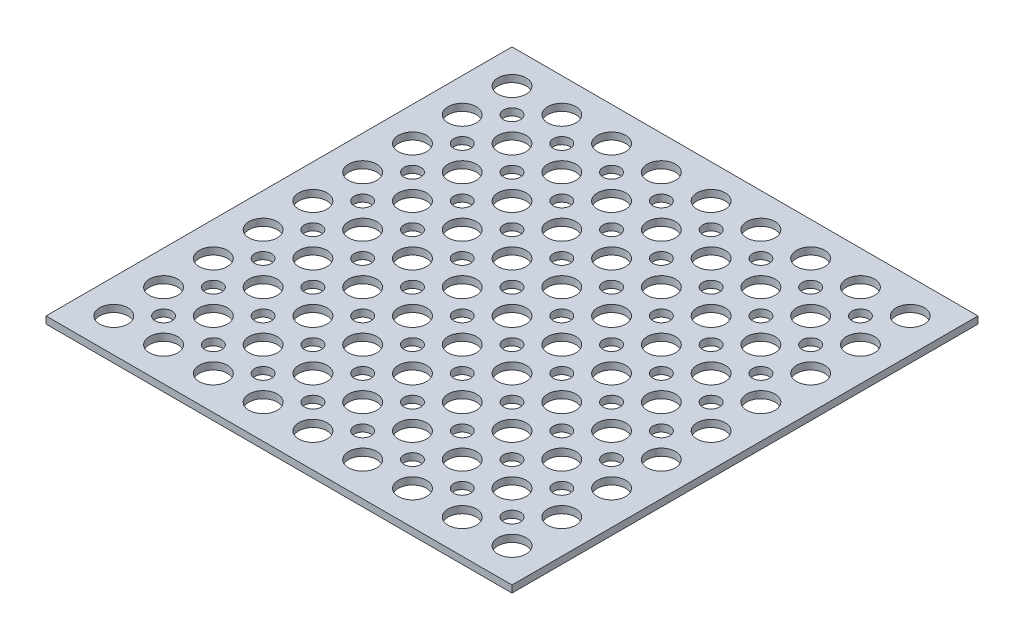
from build123d import *

# Parameters (mm, degrees)
SKETCH1_W           = 165
SKETCH1_H           = 165
BOSS_EXTRUDE1_DEPTH = 2.5
SKETCH2_R           = 5
SKETCH2_R_2         = 3
CUT_EXTRUDE1_DEPTH  = 2.5


with BuildPart() as part:
    # Sketch1 → Boss-Extrude1 (new body)
    with BuildSketch(Plane(origin=(0, 0, 0), x_dir=(1, 0, 0), z_dir=(0, 1, 0))):
        with Locations((82.5, 82.5)):
            Rectangle(SKETCH1_W, SKETCH1_H)
    extrude(amount=BOSS_EXTRUDE1_DEPTH)

    # Sketch2 → Cut-Extrude1 (cut)
    with BuildSketch(Plane(origin=(0, 2.5, 0), x_dir=(1, 0, 0), z_dir=(0, 1, 0))):
        with Locations((12, 153)):
            Circle(SKETCH2_R)
        with Locations((29.625, 153)):
            Circle(SKETCH2_R)
        with Locations((47.25, 153)):
            Circle(SKETCH2_R)
        with Locations((64.875, 153)):
            Circle(SKETCH2_R)
        with Locations((82.5, 153)):
            Circle(SKETCH2_R)
        with Locations((100.125, 153)):
            Circle(SKETCH2_R)
        with Locations((117.75, 153)):
            Circle(SKETCH2_R)
        with Locations((135.375, 153)):
            Circle(SKETCH2_R)
        with Locations((153, 153)):
            Circle(SKETCH2_R)
        with Locations((29.625, 135.375)):
            Circle(SKETCH2_R)
        with Locations((47.25, 135.375)):
            Circle(SKETCH2_R)
        with Locations((64.875, 135.375)):
            Circle(SKETCH2_R)
        with Locations((82.5, 135.375)):
            Circle(SKETCH2_R)
        with Locations((100.125, 135.375)):
            Circle(SKETCH2_R)
        with Locations((117.75, 135.375)):
            Circle(SKETCH2_R)
        with Locations((135.375, 135.375)):
            Circle(SKETCH2_R)
        with Locations((153, 135.375)):
            Circle(SKETCH2_R)
        with Locations((29.625, 117.75)):
            Circle(SKETCH2_R)
        with Locations((47.25, 117.75)):
            Circle(SKETCH2_R)
        with Locations((64.875, 117.75)):
            Circle(SKETCH2_R)
        with Locations((82.5, 117.75)):
            Circle(SKETCH2_R)
        with Locations((100.125, 117.75)):
            Circle(SKETCH2_R)
        with Locations((117.75, 117.75)):
            Circle(SKETCH2_R)
        with Locations((135.375, 117.75)):
            Circle(SKETCH2_R)
        with Locations((153, 117.75)):
            Circle(SKETCH2_R)
        with Locations((29.625, 100.125)):
            Circle(SKETCH2_R)
        with Locations((47.25, 100.125)):
            Circle(SKETCH2_R)
        with Locations((64.875, 100.125)):
            Circle(SKETCH2_R)
        with Locations((82.5, 100.125)):
            Circle(SKETCH2_R)
        with Locations((100.125, 100.125)):
            Circle(SKETCH2_R)
        with Locations((117.75, 100.125)):
            Circle(SKETCH2_R)
        with Locations((135.375, 100.125)):
            Circle(SKETCH2_R)
        with Locations((153, 100.125)):
            Circle(SKETCH2_R)
        with Locations((29.625, 82.5)):
            Circle(SKETCH2_R)
        with Locations((47.25, 82.5)):
            Circle(SKETCH2_R)
        with Locations((64.875, 82.5)):
            Circle(SKETCH2_R)
        with Locations((82.5, 82.5)):
            Circle(SKETCH2_R)
        with Locations((100.125, 82.5)):
            Circle(SKETCH2_R)
        with Locations((117.75, 82.5)):
            Circle(SKETCH2_R)
        with Locations((135.375, 82.5)):
            Circle(SKETCH2_R)
        with Locations((153, 82.5)):
            Circle(SKETCH2_R)
        with Locations((29.625, 64.875)):
            Circle(SKETCH2_R)
        with Locations((47.25, 64.875)):
            Circle(SKETCH2_R)
        with Locations((64.875, 64.875)):
            Circle(SKETCH2_R)
        with Locations((82.5, 64.875)):
            Circle(SKETCH2_R)
        with Locations((100.125, 64.875)):
            Circle(SKETCH2_R)
        with Locations((117.75, 64.875)):
            Circle(SKETCH2_R)
        with Locations((135.375, 64.875)):
            Circle(SKETCH2_R)
        with Locations((153, 64.875)):
            Circle(SKETCH2_R)
        with Locations((29.625, 47.25)):
            Circle(SKETCH2_R)
        with Locations((47.25, 47.25)):
            Circle(SKETCH2_R)
        with Locations((64.875, 47.25)):
            Circle(SKETCH2_R)
        with Locations((82.5, 47.25)):
            Circle(SKETCH2_R)
        with Locations((100.125, 47.25)):
            Circle(SKETCH2_R)
        with Locations((117.75, 47.25)):
            Circle(SKETCH2_R)
        with Locations((135.375, 47.25)):
            Circle(SKETCH2_R)
        with Locations((153, 47.25)):
            Circle(SKETCH2_R)
        with Locations((29.625, 29.625)):
            Circle(SKETCH2_R)
        with Locations((47.25, 29.625)):
            Circle(SKETCH2_R)
        with Locations((64.875, 29.625)):
            Circle(SKETCH2_R)
        with Locations((82.5, 29.625)):
            Circle(SKETCH2_R)
        with Locations((100.125, 29.625)):
            Circle(SKETCH2_R)
        with Locations((117.75, 29.625)):
            Circle(SKETCH2_R)
        with Locations((135.375, 29.625)):
            Circle(SKETCH2_R)
        with Locations((153, 29.625)):
            Circle(SKETCH2_R)
        with Locations((29.625, 12)):
            Circle(SKETCH2_R)
        with Locations((47.25, 12)):
            Circle(SKETCH2_R)
        with Locations((64.875, 12)):
            Circle(SKETCH2_R)
        with Locations((82.5, 12)):
            Circle(SKETCH2_R)
        with Locations((100.125, 12)):
            Circle(SKETCH2_R)
        with Locations((117.75, 12)):
            Circle(SKETCH2_R)
        with Locations((135.375, 12)):
            Circle(SKETCH2_R)
        with Locations((153, 12)):
            Circle(SKETCH2_R)
        with Locations((12, 135.375)):
            Circle(SKETCH2_R)
        with Locations((12, 117.75)):
            Circle(SKETCH2_R)
        with Locations((12, 100.125)):
            Circle(SKETCH2_R)
        with Locations((12, 82.5)):
            Circle(SKETCH2_R)
        with Locations((12, 64.875)):
            Circle(SKETCH2_R)
        with Locations((12, 47.25)):
            Circle(SKETCH2_R)
        with Locations((12, 29.625)):
            Circle(SKETCH2_R)
        with Locations((12, 12)):
            Circle(SKETCH2_R)
        with Locations((20.8125, 144.1875)):
            Circle(SKETCH2_R_2)
        with Locations((38.4375, 144.1875)):
            Circle(SKETCH2_R_2)
        with Locations((56.0625, 144.1875)):
            Circle(SKETCH2_R_2)
        with Locations((73.6875, 144.1875)):
            Circle(SKETCH2_R_2)
        with Locations((91.3125, 144.1875)):
            Circle(SKETCH2_R_2)
        with Locations((108.9375, 144.1875)):
            Circle(SKETCH2_R_2)
        with Locations((126.5625, 144.1875)):
            Circle(SKETCH2_R_2)
        with Locations((144.1875, 144.1875)):
            Circle(SKETCH2_R_2)
        with Locations((38.4375, 126.5625)):
            Circle(SKETCH2_R_2)
        with Locations((56.0625, 126.5625)):
            Circle(SKETCH2_R_2)
        with Locations((73.6875, 126.5625)):
            Circle(SKETCH2_R_2)
        with Locations((91.3125, 126.5625)):
            Circle(SKETCH2_R_2)
        with Locations((108.9375, 126.5625)):
            Circle(SKETCH2_R_2)
        with Locations((126.5625, 126.5625)):
            Circle(SKETCH2_R_2)
        with Locations((144.1875, 126.5625)):
            Circle(SKETCH2_R_2)
        with Locations((38.4375, 108.9375)):
            Circle(SKETCH2_R_2)
        with Locations((56.0625, 108.9375)):
            Circle(SKETCH2_R_2)
        with Locations((73.6875, 108.9375)):
            Circle(SKETCH2_R_2)
        with Locations((91.3125, 108.9375)):
            Circle(SKETCH2_R_2)
        with Locations((108.9375, 108.9375)):
            Circle(SKETCH2_R_2)
        with Locations((126.5625, 108.9375)):
            Circle(SKETCH2_R_2)
        with Locations((144.1875, 108.9375)):
            Circle(SKETCH2_R_2)
        with Locations((38.4375, 91.3125)):
            Circle(SKETCH2_R_2)
        with Locations((56.0625, 91.3125)):
            Circle(SKETCH2_R_2)
        with Locations((73.6875, 91.3125)):
            Circle(SKETCH2_R_2)
        with Locations((91.3125, 91.3125)):
            Circle(SKETCH2_R_2)
        with Locations((108.9375, 91.3125)):
            Circle(SKETCH2_R_2)
        with Locations((126.5625, 91.3125)):
            Circle(SKETCH2_R_2)
        with Locations((144.1875, 91.3125)):
            Circle(SKETCH2_R_2)
        with Locations((38.4375, 73.6875)):
            Circle(SKETCH2_R_2)
        with Locations((56.0625, 73.6875)):
            Circle(SKETCH2_R_2)
        with Locations((73.6875, 73.6875)):
            Circle(SKETCH2_R_2)
        with Locations((91.3125, 73.6875)):
            Circle(SKETCH2_R_2)
        with Locations((108.9375, 73.6875)):
            Circle(SKETCH2_R_2)
        with Locations((126.5625, 73.6875)):
            Circle(SKETCH2_R_2)
        with Locations((144.1875, 73.6875)):
            Circle(SKETCH2_R_2)
        with Locations((38.4375, 56.0625)):
            Circle(SKETCH2_R_2)
        with Locations((56.0625, 56.0625)):
            Circle(SKETCH2_R_2)
        with Locations((73.6875, 56.0625)):
            Circle(SKETCH2_R_2)
        with Locations((91.3125, 56.0625)):
            Circle(SKETCH2_R_2)
        with Locations((108.9375, 56.0625)):
            Circle(SKETCH2_R_2)
        with Locations((126.5625, 56.0625)):
            Circle(SKETCH2_R_2)
        with Locations((144.1875, 56.0625)):
            Circle(SKETCH2_R_2)
        with Locations((38.4375, 38.4375)):
            Circle(SKETCH2_R_2)
        with Locations((56.0625, 38.4375)):
            Circle(SKETCH2_R_2)
        with Locations((73.6875, 38.4375)):
            Circle(SKETCH2_R_2)
        with Locations((91.3125, 38.4375)):
            Circle(SKETCH2_R_2)
        with Locations((108.9375, 38.4375)):
            Circle(SKETCH2_R_2)
        with Locations((126.5625, 38.4375)):
            Circle(SKETCH2_R_2)
        with Locations((144.1875, 38.4375)):
            Circle(SKETCH2_R_2)
        with Locations((38.4375, 20.8125)):
            Circle(SKETCH2_R_2)
        with Locations((56.0625, 20.8125)):
            Circle(SKETCH2_R_2)
        with Locations((73.6875, 20.8125)):
            Circle(SKETCH2_R_2)
        with Locations((91.3125, 20.8125)):
            Circle(SKETCH2_R_2)
        with Locations((108.9375, 20.8125)):
            Circle(SKETCH2_R_2)
        with Locations((126.5625, 20.8125)):
            Circle(SKETCH2_R_2)
        with Locations((144.1875, 20.8125)):
            Circle(SKETCH2_R_2)
        with Locations((20.8125, 126.5625)):
            Circle(SKETCH2_R_2)
        with Locations((20.8125, 108.9375)):
            Circle(SKETCH2_R_2)
        with Locations((20.8125, 91.3125)):
            Circle(SKETCH2_R_2)
        with Locations((20.8125, 73.6875)):
            Circle(SKETCH2_R_2)
        with Locations((20.8125, 56.0625)):
            Circle(SKETCH2_R_2)
        with Locations((20.8125, 38.4375)):
            Circle(SKETCH2_R_2)
        with Locations((20.8125, 20.8125)):
            Circle(SKETCH2_R_2)
    extrude(amount=-CUT_EXTRUDE1_DEPTH, mode=Mode.SUBTRACT)


solid = part.part
